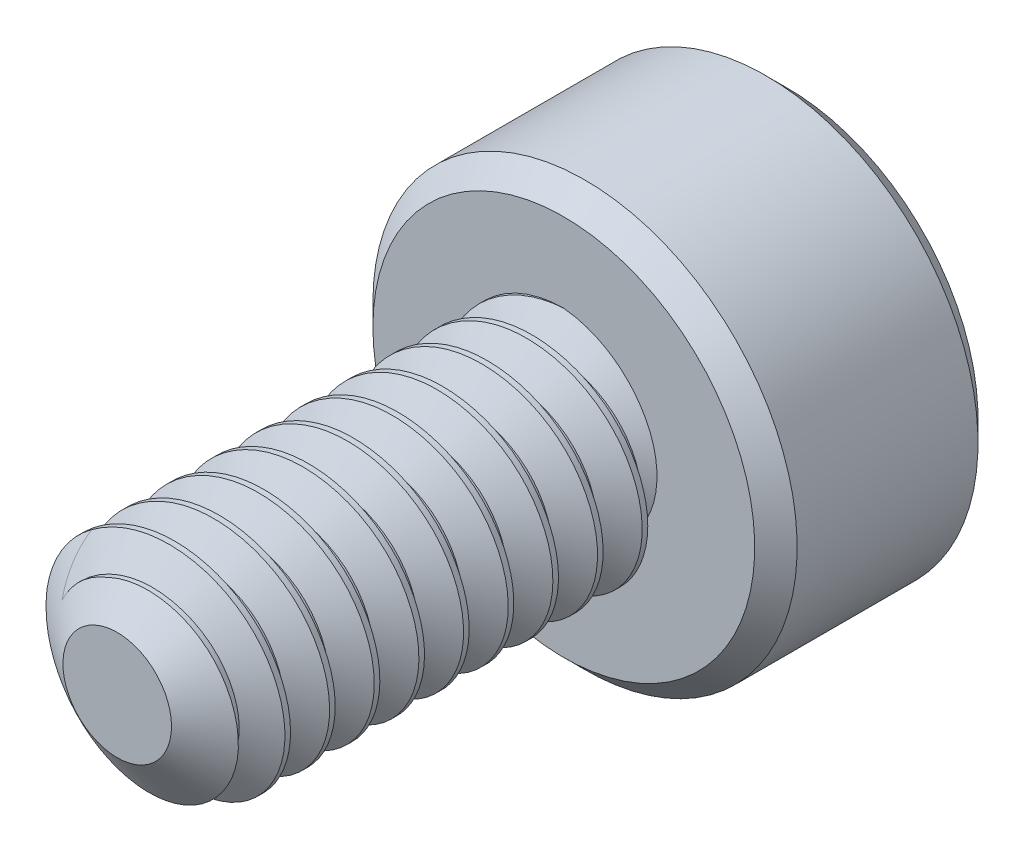
from build123d import *

# Parameters (mm, degrees)
SKETCH1_R          = 1
EXTRUDE1_DEPTH     = 4
CUT_SWEEP1_PITCH   = 0.4
SKETCH6_R          = 1.9
EXTRUDE2_DEPTH     = 2
CUT_EXTRUDE1_DEPTH = 1.125
CHAMFER1_SIZE      = 0.19


with BuildPart() as part:
    # Sketch1 → Extrude1 (new body)
    with BuildSketch(Plane.XY):
        Circle(SKETCH1_R)
    extrude(amount=-EXTRUDE1_DEPTH)

    # Cut-Sweep1: the profile of Sketch3 profile screwed along a right-hand helix of 11 turns, 6 arcs to a turn; built about Z, then put on its axis
    cut_sweep1_z = Axis((0, 0, 0), (0, 0, 1))
    cut_sweep1_corners = [(1.0003, 0, -0.350173205), (0.740192379, 0, -0.2), (0.740192379, 0, -0.15), (1.0003, 0, 0.000173205)]
    with BuildLine(mode=Mode.PRIVATE) as cut_sweep1_profile:
        Line(cut_sweep1_corners[0], cut_sweep1_corners[1])
        Line(cut_sweep1_corners[1], cut_sweep1_corners[2])
        Line(cut_sweep1_corners[2], cut_sweep1_corners[3])
        Line(cut_sweep1_corners[3], cut_sweep1_corners[0])
    cut_sweep1_cap = Face(cut_sweep1_profile.wire())
    cut_sweep1_turn_angles = [0, 30, 60, 90, 120, 150, 180, 210, 240, 270, 300, 330, 360]
    cut_sweep1_turn_weights = [1, 0.8660254037844387, 1, 0.8660254037844387, 1, 0.8660254037844387, 1, 0.8660254037844387, 1, 0.8660254037844387, 1, 0.8660254037844387, 1]
    cut_sweep1_turn_rails = [Edge.make_bspline([Vector(p[0], p[1], 0).rotate(cut_sweep1_z, cut_sweep1_turn_angles[k]) / cut_sweep1_turn_weights[k] + Vector(0, 0, p[2] + CUT_SWEEP1_PITCH * cut_sweep1_turn_angles[k] / 360) for k in range(13)], [0, 0, 0, 1, 1, 2, 2, 3, 3, 4, 4, 5, 5, 6, 6, 6], 2, cut_sweep1_turn_weights) for p in cut_sweep1_corners]
    cut_sweep1_turn_sides = [Face.make_surface_from_curves(cut_sweep1_turn_rails[p[0]], cut_sweep1_turn_rails[p[1]]) for p in [(0, 1), (1, 2), (2, 3), (3, 0)]]
    cut_sweep1 = Plane(origin=(0, 0, 0), x_dir=(0, 1, 0), z_dir=(0, 0, -1)) * Solid(Shell([*[p.moved(Location((0, 0, CUT_SWEEP1_PITCH * i))) for i in range(11) for p in cut_sweep1_turn_sides], cut_sweep1_cap, cut_sweep1_cap.rotate(cut_sweep1_z, 3960).moved(Location((0, 0, CUT_SWEEP1_PITCH * 3960 / 360)))]))
    add(cut_sweep1, mode=Mode.SUBTRACT)

    # Sketch4 → Cut-Revolve1 (revolve, cut)
    with BuildSketch(Plane(origin=(0, 0, 0), x_dir=(0, 0, -1), z_dir=(1, 0, 0)), mode=Mode.PRIVATE) as cut_revolve1_sk:
        Polygon((0.35977197, 1), (0, 0.486192379), (0, 1), align=None)
    revolve(cut_revolve1_sk.sketch.rotate(Axis((0, 0, 0), (0, 0, -1)), 278.428757719), axis=Axis((0, 0, 0), (0, 0, -1)), mode=Mode.SUBTRACT)

    # Sketch6 → Extrude2 (add)
    with BuildSketch(Plane(origin=(0, 0, -4), x_dir=(-1, 0, 0), z_dir=(0, 0, -1))):
        Circle(SKETCH6_R)
    extrude(amount=EXTRUDE2_DEPTH)

    # Sketch7 → Cut-Extrude1 (cut)
    with BuildSketch(Plane(origin=(0, 0, -6), x_dir=(-1, 0, 0), z_dir=(0, 0, -1))):
        Polygon((0, 0.866025404), (-0.75, 0.433012702), (-0.75, -0.433012702), (0, -0.866025404), (0.75, -0.433012702), (0.75, 0.433012702), align=None)
    extrude(amount=-CUT_EXTRUDE1_DEPTH, mode=Mode.SUBTRACT)

    # Cut-Extrude2 cone 1 section (through the dimple's axis) → Cut-Extrude2 (revolve, cut)
    with BuildSketch(Plane(origin=(0, 0, -6), x_dir=(0, 1, 0), z_dir=(1, 0, 0))):
        Polygon((0, 0), (0.866025404, 0), (0, 0.866025404), align=None)
    revolve(axis=Axis((0, 0, -6), (0, 0, 1)), mode=Mode.SUBTRACT)

    # Chamfer1
    chamfer1_edges = [part.edges().sort_by_distance(p)[0] for p in [
        (1.9, 0, -4),
        (1.9, 0, -6),
    ]]
    chamfer(chamfer1_edges, length=CHAMFER1_SIZE)


solid = part.part
